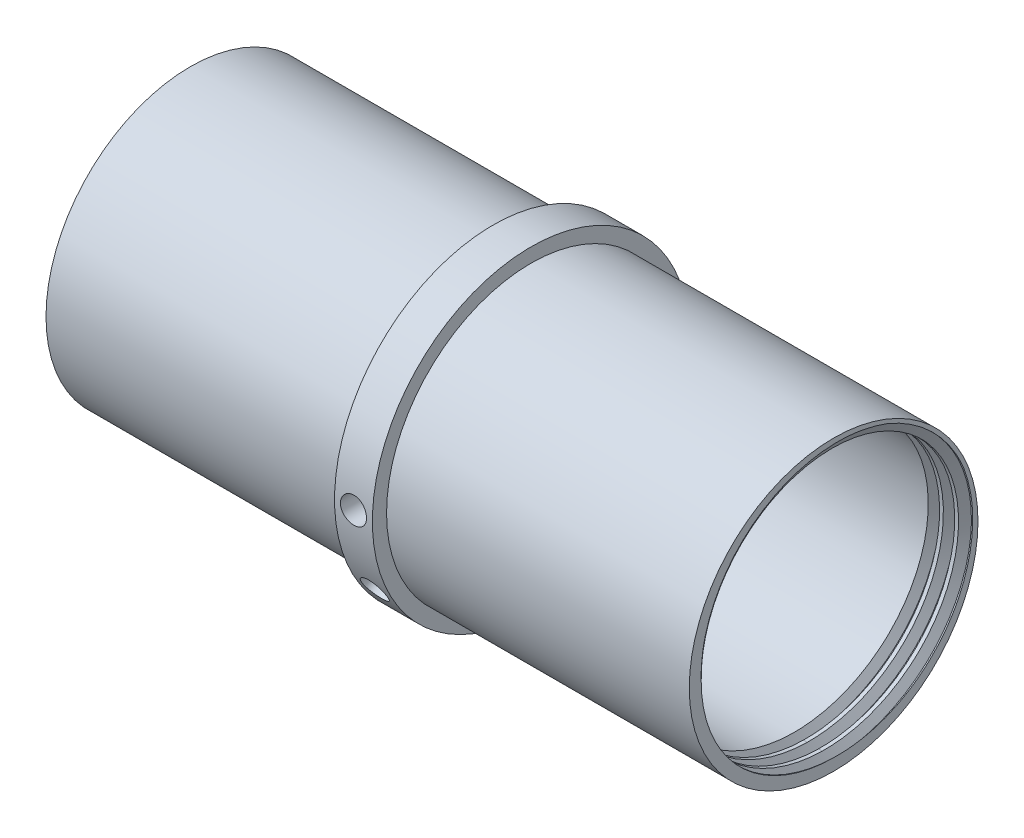
from build123d import *

# Parameters (mm, degrees)
SKETCH1_R               = 38.15
SKETCH1_R_2             = 35
BOSS_EXTRUDE1_DEPTH     = 85
SKETCH1_3_R             = 41.9
SKETCH1_3_R_2           = 38.15
BOSS_EXTRUDE2_DEPTH     = 5
THREAD2_PITCH           = 4
THREAD3_PITCH           = 4
CUT_EXTRUDE1_REACH      = 128.503
CUT_EXTRUDE1_END_RADIUS = 35
SKETCH2_R               = 3.45
CIRPATTERN1_COUNT       = 4
CIRPATTERN1_ANGLE       = 90


with BuildPart() as part:
    # Sketch1 → Boss-Extrude1 (new, symmetric)
    with BuildSketch(Plane(origin=(0, 0, 0), x_dir=(0, 0, -1), z_dir=(1, 0, 0))):
        Circle(SKETCH1_R)
        Circle(SKETCH1_R_2, mode=Mode.SUBTRACT)
    extrude(amount=BOSS_EXTRUDE1_DEPTH, both=True)

    # Sketch1<3> → Boss-Extrude2 (add, symmetric)
    with BuildSketch(Plane(origin=(0, 0, 0), x_dir=(0, 0, -1), z_dir=(1, 0, 0))):
        Circle(SKETCH1_3_R)
        Circle(SKETCH1_3_R_2, mode=Mode.SUBTRACT)
    extrude(amount=BOSS_EXTRUDE2_DEPTH, both=True)

    # Thread2: the profile of Thread Profile2 profile screwed along a right-hand helix of 5 turns, 12 arcs to a turn; built about Z, then put on its axis
    thread2_z = Axis((0, 0, 0), (0, 0, 1))
    thread2_corners = [(34.9997, 0, -0.000173205), (37.1650635, 0, 1.249999995), (37.1650635, 0, 1.749999995), (34.9997, 0, 3.000173194)]
    with BuildLine(mode=Mode.PRIVATE) as thread2_profile:
        Line(thread2_corners[0], thread2_corners[1])
        Line(thread2_corners[1], thread2_corners[2])
        Line(thread2_corners[2], thread2_corners[3])
        Line(thread2_corners[3], thread2_corners[0])
    thread2_cap = Face(thread2_profile.wire())
    thread2_turn_angles = [0, 15, 30, 45, 60, 75, 90, 105, 120, 135, 150, 165, 180, 195, 210, 225, 240, 255, 270, 285, 300, 315, 330, 345, 360]
    thread2_turn_weights = [1, 0.9659258262890683, 1, 0.9659258262890683, 1, 0.9659258262890683, 1, 0.9659258262890683, 1, 0.9659258262890683, 1, 0.9659258262890683, 1, 0.9659258262890683, 1, 0.9659258262890683, 1, 0.9659258262890683, 1, 0.9659258262890683, 1, 0.9659258262890683, 1, 0.9659258262890683, 1]
    thread2_turn_rails = [Edge.make_bspline([Vector(p[0], p[1], 0).rotate(thread2_z, thread2_turn_angles[k]) / thread2_turn_weights[k] + Vector(0, 0, p[2] + THREAD2_PITCH * thread2_turn_angles[k] / 360) for k in range(25)], [0, 0, 0, 1, 1, 2, 2, 3, 3, 4, 4, 5, 5, 6, 6, 7, 7, 8, 8, 9, 9, 10, 10, 11, 11, 12, 12, 12], 2, thread2_turn_weights) for p in thread2_corners]
    thread2_turn_sides = [Face.make_surface_from_curves(thread2_turn_rails[p[0]], thread2_turn_rails[p[1]]) for p in [(0, 1), (1, 2), (2, 3), (3, 0)]]
    thread2 = Plane(origin=(96, 0, 0), x_dir=(0, 0, 1), z_dir=(-1, 0, 0)) * Solid(Shell([*[p.moved(Location((0, 0, THREAD2_PITCH * i))) for i in range(5) for p in thread2_turn_sides], thread2_cap, thread2_cap.rotate(thread2_z, 1800).moved(Location((0, 0, THREAD2_PITCH * 1800 / 360)))]))
    add(thread2, mode=Mode.SUBTRACT)

    # Thread3: the profile of Thread Profile3 profile screwed along a right-hand helix of 5 turns, 12 arcs to a turn; built about Z, then put on its axis
    thread3_z = Axis((0, 0, 0), (0, 0, 1))
    thread3_corners = [(34.9997, 0, -0.000173205), (37.1650635, 0, 1.249999995), (37.1650635, 0, 1.749999995), (34.9997, 0, 3.000173194)]
    with BuildLine(mode=Mode.PRIVATE) as thread3_profile:
        Line(thread3_corners[0], thread3_corners[1])
        Line(thread3_corners[1], thread3_corners[2])
        Line(thread3_corners[2], thread3_corners[3])
        Line(thread3_corners[3], thread3_corners[0])
    thread3_cap = Face(thread3_profile.wire())
    thread3_turn_angles = [0, 15, 30, 45, 60, 75, 90, 105, 120, 135, 150, 165, 180, 195, 210, 225, 240, 255, 270, 285, 300, 315, 330, 345, 360]
    thread3_turn_weights = [1, 0.9659258262890683, 1, 0.9659258262890683, 1, 0.9659258262890683, 1, 0.9659258262890683, 1, 0.9659258262890683, 1, 0.9659258262890683, 1, 0.9659258262890683, 1, 0.9659258262890683, 1, 0.9659258262890683, 1, 0.9659258262890683, 1, 0.9659258262890683, 1, 0.9659258262890683, 1]
    thread3_turn_rails = [Edge.make_bspline([Vector(p[0], p[1], 0).rotate(thread3_z, thread3_turn_angles[k]) / thread3_turn_weights[k] + Vector(0, 0, p[2] + THREAD3_PITCH * thread3_turn_angles[k] / 360) for k in range(25)], [0, 0, 0, 1, 1, 2, 2, 3, 3, 4, 4, 5, 5, 6, 6, 7, 7, 8, 8, 9, 9, 10, 10, 11, 11, 12, 12, 12], 2, thread3_turn_weights) for p in thread3_corners]
    thread3_turn_sides = [Face.make_surface_from_curves(thread3_turn_rails[p[0]], thread3_turn_rails[p[1]]) for p in [(0, 1), (1, 2), (2, 3), (3, 0)]]
    thread3 = Plane(origin=(-96, 0, 0), x_dir=(0, 0, -1), z_dir=(1, 0, 0)) * Solid(Shell([*[p.moved(Location((0, 0, THREAD3_PITCH * i))) for i in range(5) for p in thread3_turn_sides], thread3_cap, thread3_cap.rotate(thread3_z, 1800).moved(Location((0, 0, THREAD3_PITCH * 1800 / 360)))]))
    add(thread3, mode=Mode.SUBTRACT)

    # Cut-Extrude1: up to this cylinder (the profile starts outside it)
    cut_extrude1_end = Plane(origin=(0, 0, 0), z_dir=(-1, 0, 0)) * Cylinder(CUT_EXTRUDE1_END_RADIUS, 328.006, mode=Mode.PRIVATE)
    # Sketch2 → Cut-Extrude1 (cut, up to the surface)
    with BuildSketch(Plane(origin=(0, -41.9, 0), x_dir=(-1, 0, 0), z_dir=(0, -1, 0)), mode=Mode.PRIVATE) as cut_extrude1_sk1:
        with Locations(Location((0, 0, 0), (0, 0, 90))):
            Circle(SKETCH2_R)
    cut_extrude1_tool1 = extrude(cut_extrude1_sk1.sketch, amount=-CUT_EXTRUDE1_REACH, mode=Mode.PRIVATE) - cut_extrude1_end
    cut_extrude1 = cut_extrude1_tool1.solids().sort_by_distance((0, -41.9, 0))[0]
    add(cut_extrude1, mode=Mode.SUBTRACT)

    # CirPattern1: Cut-Extrude1 ×4 about axis
    cirpattern1_axis = Axis((85, 0, 0), (-1, 0, 0))
    for i in range(1, CIRPATTERN1_COUNT):
        add(cut_extrude1.rotate(cirpattern1_axis, i * CIRPATTERN1_ANGLE / (CIRPATTERN1_COUNT - 1)), mode=Mode.SUBTRACT)


solid = part.part
